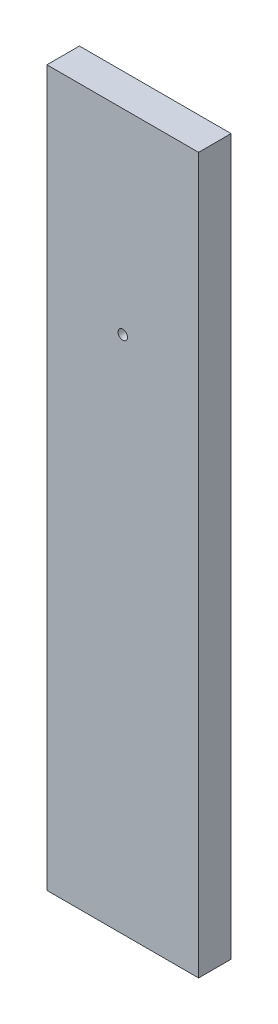
from build123d import *

# Parameters (mm, degrees)
SKETCH1_W           = 88.9
SKETCH1_H           = 19.05
BOSS_EXTRUDE1_DEPTH = 419.1
SKETCH2_R           = 2.778125
CUT_EXTRUDE1_DEPTH  = 429.848367725


with BuildPart() as part:
    # Sketch1 → Boss-Extrude1 (new body)
    with BuildSketch(Plane(origin=(0, 0, 0), x_dir=(1, 0, 0), z_dir=(0, 1, 0))):
        with Locations((44.45, 9.525)):
            Rectangle(SKETCH1_W, SKETCH1_H)
    extrude(amount=BOSS_EXTRUDE1_DEPTH)

    # Sketch2 → Cut-Extrude1 (cut, through all)
    with BuildSketch(Plane.XY):
        with Locations((44.45, 304.325812123)):
            Circle(SKETCH2_R)
    extrude(amount=-CUT_EXTRUDE1_DEPTH, mode=Mode.SUBTRACT)


solid = part.part
